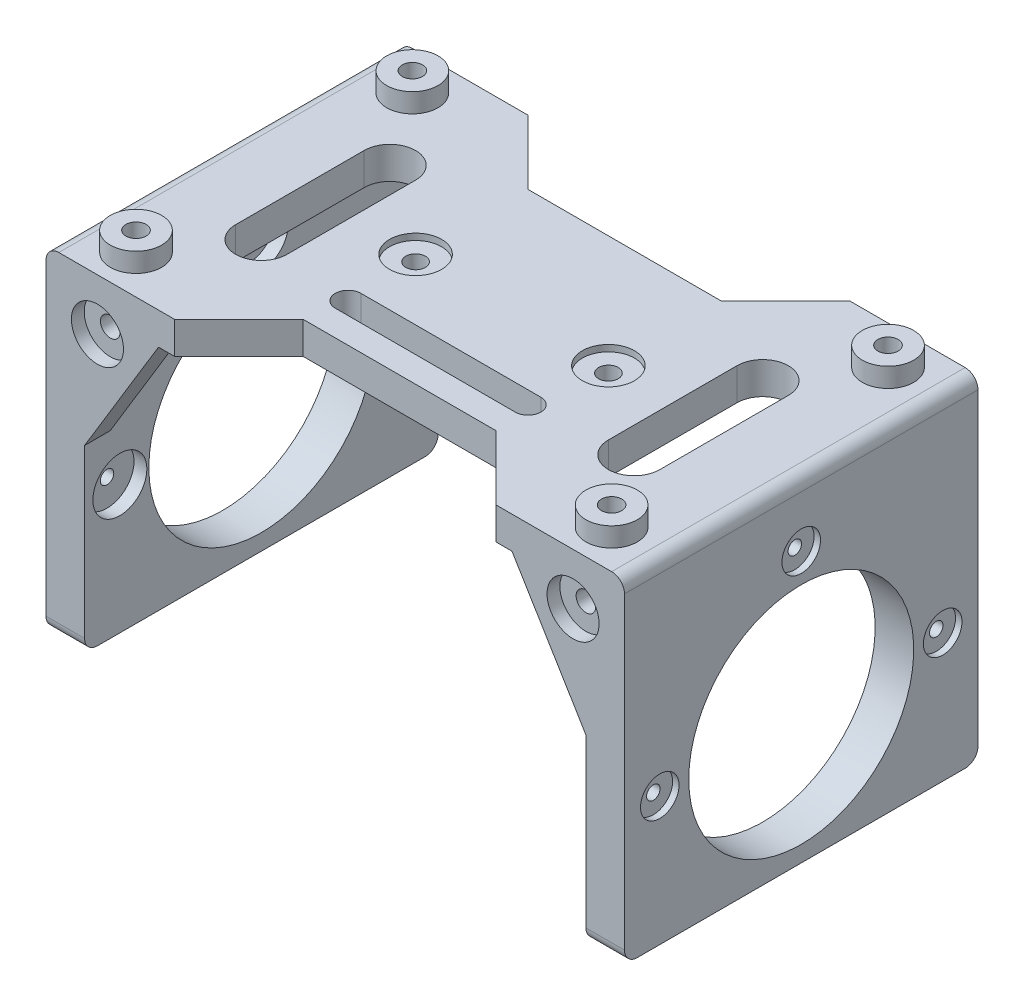
from build123d import *

# Parameters (mm, degrees)
EXTRUDE_1_DEPTH      = 52
CUT_EXTRUDE_1_DEPTH  = 118.596768663
CUT_EXTRUDE_2_REACH  = 117.473
SKETCH_3_W           = 11.5
SKETCH_3_H           = 47
CUT_EXTRUDE_3_REACH  = 119.597
SKETCH_15_R          = 4
SKETCH_15_R_2        = 1.575
EXTRUDE_2_DEPTH      = 3
SKETCH_5_R           = 17.5
CUT_EXTRUDE_4_DEPTH  = 119.953772534
SKETCH_10_R          = 3
CUT_EXTRUDE_5_DEPTH  = 1
SKETCH_11_R          = 4.2
CUT_EXTRUDE_6_DEPTH  = 2
CUT_EXTRUDE_START    = -1
SKETCH_12_R          = 3
CUT_EXTRUDE_7_DEPTH  = 1
CUT_EXTRUDE_START_2  = -2
SKETCH_13_R          = 4.2
CUT_EXTRUDE_8_DEPTH  = 2
SKETCH_14_R          = 1.05
CUT_EXTRUDE_9_DEPTH  = 119.198984767
SKETCH_17_R          = 1.575
CUT_EXTRUDE_10_DEPTH = 118.596768663
FILLET_2_R           = 2
SKETCH_18_R          = 1.525
CUT_EXTRUDE_11_DEPTH = 119.953772534
SKETCH_19_R          = 4.05
CUT_EXTRUDE_12_DEPTH = 2
SKETCH_20_R          = 4.05
CUT_EXTRUDE_13_DEPTH = 2
SKETCH_21_R          = 1.525
CUT_EXTRUDE_14_DEPTH = 118.596768663
SKETCH_22_R          = 4.05
CUT_EXTRUDE_15_DEPTH = 1
SKETCH_23_R          = 4.05
CUT_EXTRUDE_16_DEPTH = 1


with BuildPart() as part:
    # 草图1 → 凸台-拉伸1 (new body)
    with BuildSketch(Plane(origin=(0, 0, 0), x_dir=(1, 0, 0), z_dir=(0, 1, 0))):
        Polygon((0, 0), (20, 0), (30, -10), (60, -10), (70, 0), (90, 0), (90, -55), (70, -55), (60, -45), (30, -45), (20, -55), (0, -55), align=None)
    extrude(amount=EXTRUDE_1_DEPTH)

    # 草图2 → 切除-拉伸1 (cut, through all)
    with BuildSketch(Plane.XY.offset(55)):
        Polygon((6, 0), (6, 28), (17.5, 47), (72.5, 47), (84, 28), (84, 0), align=None)
    extrude(amount=-CUT_EXTRUDE_1_DEPTH, mode=Mode.SUBTRACT)

    # 草图3 → 切除-拉伸2 (cut, up to next)
    with BuildSketch(Plane.XZ.offset(-47), mode=Mode.PRIVATE) as cut_extrude_2_sk1:
        with Locations((11.75, 27.5)):
            Rectangle(SKETCH_3_W, SKETCH_3_H)
    cut_extrude_2_tool1 = extrude(cut_extrude_2_sk1.sketch, amount=CUT_EXTRUDE_2_REACH, mode=Mode.PRIVATE) & part.part
    # 草图3 → 切除-拉伸2 (cut, up to next)
    with BuildSketch(Plane.XZ.offset(-47), mode=Mode.PRIVATE) as cut_extrude_2_sk2:
        with Locations((78.25, 27.5)):
            Rectangle(SKETCH_3_W, SKETCH_3_H)
    cut_extrude_2_tool2 = extrude(cut_extrude_2_sk2.sketch, amount=CUT_EXTRUDE_2_REACH, mode=Mode.PRIVATE) & part.part
    add(cut_extrude_2_tool1.solids().sort_by_distance((11.75, 47, 27.5))[0], mode=Mode.SUBTRACT)
    add(cut_extrude_2_tool2.solids().sort_by_distance((78.25, 47, 27.5))[0], mode=Mode.SUBTRACT)

    # 草图4 → 切除-拉伸3 (cut, up to next)
    with BuildSketch(Plane(origin=(0, 52, 0), x_dir=(1, 0, 0), z_dir=(0, 1, 0)), mode=Mode.PRIVATE) as cut_extrude_3_sk1:
        with BuildLine():
            Line((70, -37.5), (70, -17.5))
            ThreePointArc((70, -17.5), (74, -13.5), (78, -17.5))
            Line((78, -17.5), (78, -37.5))
            ThreePointArc((78, -37.5), (74, -41.5), (70, -37.5))
        make_face()
    cut_extrude_3_tool1 = extrude(cut_extrude_3_sk1.sketch, amount=-CUT_EXTRUDE_3_REACH, mode=Mode.PRIVATE) & part.part
    # 草图4 → 切除-拉伸3 (cut, up to next)
    with BuildSketch(Plane(origin=(0, 52, 0), x_dir=(1, 0, 0), z_dir=(0, 1, 0)), mode=Mode.PRIVATE) as cut_extrude_3_sk2:
        with BuildLine():
            Line((12, -37.5), (12, -17.5))
            ThreePointArc((12, -17.5), (16, -13.5), (20, -17.5))
            Line((20, -17.5), (20, -37.5))
            ThreePointArc((20, -37.5), (16, -41.5), (12, -37.5))
        make_face()
    cut_extrude_3_tool2 = extrude(cut_extrude_3_sk2.sketch, amount=-CUT_EXTRUDE_3_REACH, mode=Mode.PRIVATE) & part.part
    # 草图4 → 切除-拉伸3 (cut, up to next)
    with BuildSketch(Plane(origin=(0, 52, 0), x_dir=(1, 0, 0), z_dir=(0, 1, 0)), mode=Mode.PRIVATE) as cut_extrude_3_sk3:
        with BuildLine():
            Line((31, -37), (59, -37))
            ThreePointArc((59, -37), (61, -39), (59, -41))
            Line((59, -41), (31, -41))
            ThreePointArc((31, -41), (29, -39), (31, -37))
        make_face()
    cut_extrude_3_tool3 = extrude(cut_extrude_3_sk3.sketch, amount=-CUT_EXTRUDE_3_REACH, mode=Mode.PRIVATE) & part.part
    add(cut_extrude_3_tool1.solids().sort_by_distance((74, 52, 27.5))[0], mode=Mode.SUBTRACT)
    add(cut_extrude_3_tool2.solids().sort_by_distance((16, 52, 27.5))[0], mode=Mode.SUBTRACT)
    add(cut_extrude_3_tool3.solids().sort_by_distance((45, 52, 39))[0], mode=Mode.SUBTRACT)

    # 草图15 → 凸台-拉伸2 (add)
    # profile 1 of 4: a face of its own
    with BuildSketch(Plane(origin=(0, 52, 0), x_dir=(1, 0, 0), z_dir=(0, 1, 0))):
        with Locations((8, -6)):
            Circle(SKETCH_15_R)
        with Locations((8, -6)):
            Circle(SKETCH_15_R_2, mode=Mode.SUBTRACT)
    # profile 2 of 4: a face of its own
    with BuildSketch(Plane(origin=(0, 52, 0), x_dir=(1, 0, 0), z_dir=(0, 1, 0))):
        with Locations((82, -6)):
            Circle(SKETCH_15_R)
        with Locations((82, -6)):
            Circle(SKETCH_15_R_2, mode=Mode.SUBTRACT)
    # profile 3 of 4: a face of its own
    with BuildSketch(Plane(origin=(0, 52, 0), x_dir=(1, 0, 0), z_dir=(0, 1, 0))):
        with Locations((82, -49)):
            Circle(SKETCH_15_R)
        with Locations((82, -49)):
            Circle(SKETCH_15_R_2, mode=Mode.SUBTRACT)
    # profile 4 of 4: a face of its own
    with BuildSketch(Plane(origin=(0, 52, 0), x_dir=(1, 0, 0), z_dir=(0, 1, 0))):
        with Locations((8, -49)):
            Circle(SKETCH_15_R)
        with Locations((8, -49)):
            Circle(SKETCH_15_R_2, mode=Mode.SUBTRACT)
    extrude(amount=EXTRUDE_2_DEPTH)

    # 草图5 → 切除-拉伸4 (cut, through all)
    with BuildSketch(Plane.ZY):
        with Locations((27.5, 20)):
            Circle(SKETCH_5_R)
    extrude(amount=-CUT_EXTRUDE_4_DEPTH, mode=Mode.SUBTRACT)

    # 草图10 → 切除-拉伸5 (cut)
    with BuildSketch(Plane.ZY):
        with Locations((5.492189406, 20)):
            Circle(SKETCH_10_R)
        with Locations((27.5, 42.007810594)):
            Circle(SKETCH_10_R)
        with Locations((49.507810594, 20)):
            Circle(SKETCH_10_R)
    extrude(amount=-CUT_EXTRUDE_5_DEPTH, mode=Mode.SUBTRACT)

    # 草图11 → 切除-拉伸6 (cut)
    with BuildSketch(Plane(origin=(6, 0, 0), x_dir=(0, 0, -1), z_dir=(1, 0, 0))):
        with Locations((-49.507810594, 20)):
            Circle(SKETCH_11_R)
        with Locations((-5.492189406, 20)):
            Circle(SKETCH_11_R)
        with Locations((-27.5, 42.007810594)):
            Circle(SKETCH_11_R)
    extrude(amount=-CUT_EXTRUDE_6_DEPTH, mode=Mode.SUBTRACT)

    # 草图12 → 切除-拉伸7 (cut)
    with BuildSketch(Plane(origin=(90, 0, 0), x_dir=(0, 0, -1), z_dir=(1, 0, 0)).offset(CUT_EXTRUDE_START)):
        with Locations((-49.507810594, 20)):
            Circle(SKETCH_12_R)
        with Locations((-5.492189406, 20)):
            Circle(SKETCH_12_R)
        with Locations((-27.5, 42.007810594)):
            Circle(SKETCH_12_R)
    extrude(amount=CUT_EXTRUDE_7_DEPTH, mode=Mode.SUBTRACT)

    # 草图13 → 切除-拉伸8 (cut)
    with BuildSketch(Plane.ZY.offset(-84).offset(CUT_EXTRUDE_START_2)):
        with Locations((49.507810594, 20)):
            Circle(SKETCH_13_R)
        with Locations((5.492189406, 20)):
            Circle(SKETCH_13_R)
        with Locations((27.5, 42.007810594)):
            Circle(SKETCH_13_R)
    extrude(amount=CUT_EXTRUDE_8_DEPTH, mode=Mode.SUBTRACT)

    # 草图14 → 切除-拉伸9 (cut, through all)
    with BuildSketch(Plane(origin=(89, 0, 0), x_dir=(0, 0, -1), z_dir=(1, 0, 0))):
        with Locations((-49.507810594, 20)):
            Circle(SKETCH_14_R)
        with Locations((-27.5, 42.007810594)):
            Circle(SKETCH_14_R)
        with Locations((-5.492189406, 20)):
            Circle(SKETCH_14_R)
    extrude(amount=-CUT_EXTRUDE_9_DEPTH, mode=Mode.SUBTRACT)

    # 草图17 → 切除-拉伸10 (cut, through all)
    with BuildSketch(Plane(origin=(0, 52, 0), x_dir=(1, 0, 0), z_dir=(0, 1, 0))):
        with Locations((8, -49)):
            Circle(SKETCH_17_R)
        with Locations((82, -49)):
            Circle(SKETCH_17_R)
        with Locations((82, -6)):
            Circle(SKETCH_17_R)
        with Locations((8, -6)):
            Circle(SKETCH_17_R)
    extrude(amount=-CUT_EXTRUDE_10_DEPTH, mode=Mode.SUBTRACT)

    # 圆角2
    fillet_2_edges = [part.edges().sort_by_distance(p)[0] for p in [
        (0, 52, 27.5),
        (90, 52, 27.5),
        (3, 0, 55),
        (3, 0, 0),
        (87, 0, 55),
        (87, 0, 0),
    ]]
    fillet(fillet_2_edges, radius=FILLET_2_R)

    # 草图18 → 切除-拉伸11 (cut, through all)
    with BuildSketch(Plane.XY.offset(55)):
        with Locations((8, 44)):
            Circle(SKETCH_18_R)
        with Locations((82, 44)):
            Circle(SKETCH_18_R)
    extrude(amount=-CUT_EXTRUDE_11_DEPTH, mode=Mode.SUBTRACT)

    # 草图19 → 切除-拉伸12 (cut)
    with BuildSketch(Plane.XY.offset(55)):
        with Locations((8, 44)):
            Circle(SKETCH_19_R)
        with Locations((82, 44)):
            Circle(SKETCH_19_R)
    extrude(amount=-CUT_EXTRUDE_12_DEPTH, mode=Mode.SUBTRACT)

    # 草图20 → 切除-拉伸13 (cut)
    with BuildSketch(Plane(origin=(0, 0, 0), x_dir=(-1, 0, 0), z_dir=(0, 0, -1)).offset(CUT_EXTRUDE_START_2)):
        with Locations((-82, 44)):
            Circle(SKETCH_20_R)
        with Locations((-8, 44)):
            Circle(SKETCH_20_R)
    extrude(amount=CUT_EXTRUDE_13_DEPTH, mode=Mode.SUBTRACT)

    # 草图21 → 切除-拉伸14 (cut, through all)
    with BuildSketch(Plane(origin=(0, 52, 0), x_dir=(1, 0, 0), z_dir=(0, 1, 0))):
        with Locations((30, -27.5)):
            Circle(SKETCH_21_R)
        with Locations((60, -27.5)):
            Circle(SKETCH_21_R)
    extrude(amount=-CUT_EXTRUDE_14_DEPTH, mode=Mode.SUBTRACT)

    # 草图22 → 切除-拉伸15 (cut)
    with BuildSketch(Plane(origin=(0, 52, 0), x_dir=(1, 0, 0), z_dir=(0, 1, 0))):
        with Locations((30, -27.5)):
            Circle(SKETCH_22_R)
        with Locations((60, -27.5)):
            Circle(SKETCH_22_R)
    extrude(amount=-CUT_EXTRUDE_15_DEPTH, mode=Mode.SUBTRACT)

    # 草图23 → 切除-拉伸16 (cut)
    with BuildSketch(Plane.XZ.offset(-47).offset(CUT_EXTRUDE_START)):
        with Locations((30, 27.5)):
            Circle(SKETCH_23_R)
        with Locations((60, 27.5)):
            Circle(SKETCH_23_R)
    extrude(amount=CUT_EXTRUDE_16_DEPTH, mode=Mode.SUBTRACT)


solid = part.part
